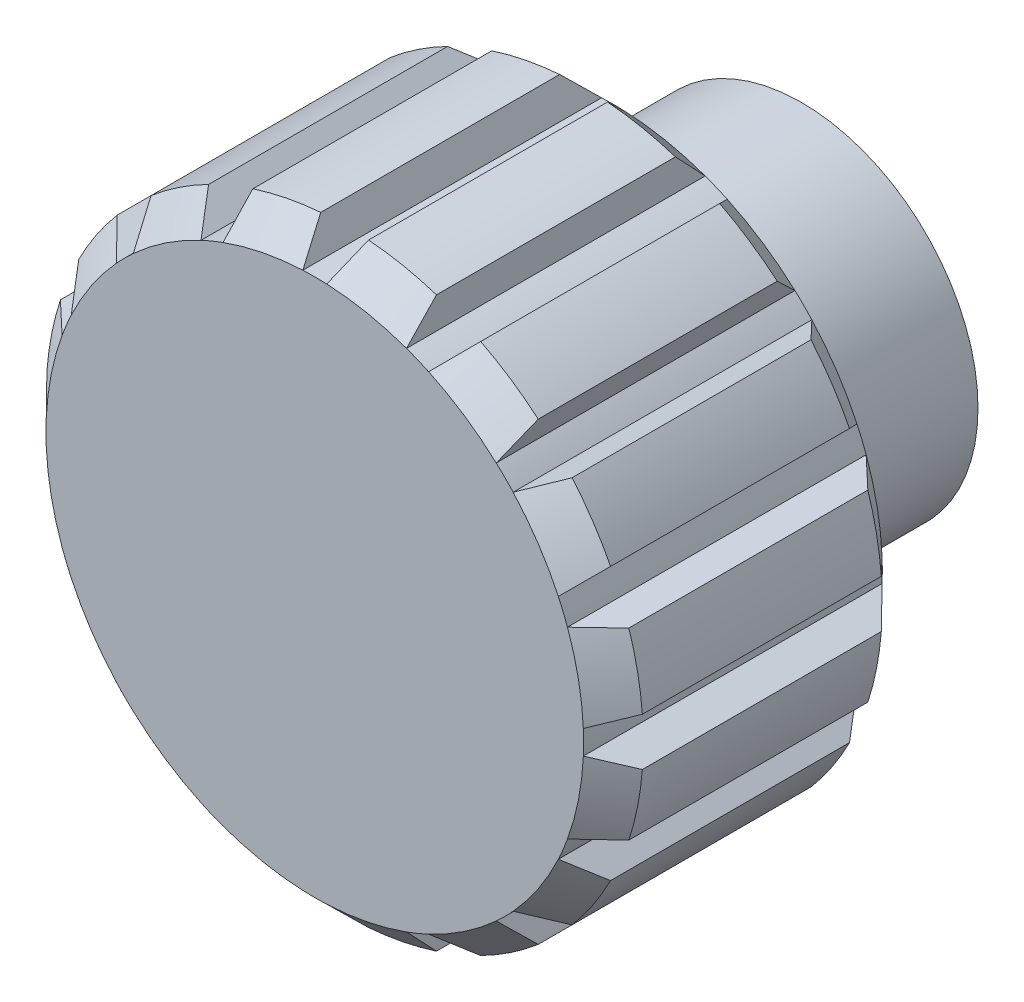
from build123d import *

# Parameters (mm, degrees)
SKETCH1_R           = 7.5
SKETCH1_R_2         = 3.5
BOSS_EXTRUDE1_DEPTH = 8
SKETCH2_R           = 12.7
BOSS_EXTRUDE2_DEPTH = 12.7
CHAMFER1_SIZE       = 1.27
CUT_EXTRUDE2_DEPTH  = 12.7


with BuildPart() as part:
    # Sketch1 → Boss-Extrude1 (new body)
    with BuildSketch(Plane.XY):
        Circle(SKETCH1_R)
        Circle(SKETCH1_R_2, mode=Mode.SUBTRACT)
    extrude(amount=BOSS_EXTRUDE1_DEPTH)

    # Sketch2 → Boss-Extrude2 (add)
    with BuildSketch(Plane.XY.offset(8)):
        Circle(SKETCH2_R)
    extrude(amount=BOSS_EXTRUDE2_DEPTH)

    # Chamfer1
    chamfer1_edges = [part.edges().sort_by_distance(p)[0] for p in [
        (-12.7, 0, 20.7),
        (-12.7, 0, 8),
    ]]
    chamfer(chamfer1_edges, length=CHAMFER1_SIZE)

    # Sketch3 → Cut-Extrude2 (cut)
    with BuildSketch(Plane.XY.offset(20.7)):
        with BuildLine():
            Line((-1.494578623, 13.823081897), (-0.508, 11.418705531))
            ThreePointArc((-0.508, 11.418705531), (0, 11.43), (0.508, 11.418705531))
            Line((0.508, 11.418705531), (1.494578623, 13.823081897))
            Line((1.494578623, 13.823081897), (-1.494578623, 13.823081897))
        make_face()
        with BuildLine():
            Line((3.909053826, 13.342812918), (6.670675026, 12.198911963))
            Line((6.670675026, 12.198911963), (4.839080228, 10.355105144))
            ThreePointArc((4.839080228, 10.355105144), (4.374071632, 10.559943057), (3.900418623, 10.743911511))
            Line((3.900418623, 10.743911511), (3.909053826, 13.342812918))
        make_face()
        with BuildLine():
            Line((8.717568266, 10.831221626), (10.831221626, 8.717568266))
            Line((10.831221626, 8.717568266), (8.433454358, 7.715033868))
            ThreePointArc((8.433454358, 7.715033868), (8.082230509, 8.082230509), (7.715033868, 8.433454358))
            Line((7.715033868, 8.433454358), (8.717568266, 10.831221626))
        make_face()
        with BuildLine():
            Line((12.198911963, 6.670675026), (13.342812918, 3.909053826))
            Line((13.342812918, 3.909053826), (10.743911511, 3.900418623))
            ThreePointArc((10.743911511, 3.900418623), (10.559943057, 4.374071632), (10.355105144, 4.839080228))
            Line((10.355105144, 4.839080228), (12.198911963, 6.670675026))
        make_face()
        with BuildLine():
            Line((13.823081897, 1.494578623), (13.823081897, -1.494578623))
            Line((13.823081897, -1.494578623), (11.418705531, -0.508))
            ThreePointArc((11.418705531, -0.508), (11.43, 0), (11.418705531, 0.508))
            Line((11.418705531, 0.508), (13.823081897, 1.494578623))
        make_face()
        with BuildLine():
            Line((13.342812918, -3.909053826), (12.198911963, -6.670675026))
            Line((12.198911963, -6.670675026), (10.355105144, -4.839080228))
            ThreePointArc((10.355105144, -4.839080228), (10.559943057, -4.374071632), (10.743911511, -3.900418623))
            Line((10.743911511, -3.900418623), (13.342812918, -3.909053826))
        make_face()
        with BuildLine():
            Line((10.831221626, -8.717568266), (8.717568266, -10.831221626))
            Line((8.717568266, -10.831221626), (7.715033868, -8.433454358))
            ThreePointArc((7.715033868, -8.433454358), (8.082230509, -8.082230509), (8.433454358, -7.715033868))
            Line((8.433454358, -7.715033868), (10.831221626, -8.717568266))
        make_face()
        with BuildLine():
            Line((6.670675026, -12.198911963), (3.909053826, -13.342812918))
            Line((3.909053826, -13.342812918), (3.900418623, -10.743911511))
            ThreePointArc((3.900418623, -10.743911511), (4.374071632, -10.559943057), (4.839080228, -10.355105144))
            Line((4.839080228, -10.355105144), (6.670675026, -12.198911963))
        make_face()
        with BuildLine():
            Line((1.494578623, -13.823081897), (-1.494578623, -13.823081897))
            Line((-1.494578623, -13.823081897), (-0.508, -11.418705531))
            ThreePointArc((-0.508, -11.418705531), (0, -11.43), (0.508, -11.418705531))
            Line((0.508, -11.418705531), (1.494578623, -13.823081897))
        make_face()
        with BuildLine():
            Line((-3.909053826, -13.342812918), (-6.670675026, -12.198911963))
            Line((-6.670675026, -12.198911963), (-4.839080228, -10.355105144))
            ThreePointArc((-4.839080228, -10.355105144), (-4.374071632, -10.559943057), (-3.900418623, -10.743911511))
            Line((-3.900418623, -10.743911511), (-3.909053826, -13.342812918))
        make_face()
        with BuildLine():
            Line((-8.717568266, -10.831221626), (-10.831221626, -8.717568266))
            Line((-10.831221626, -8.717568266), (-8.433454358, -7.715033868))
            ThreePointArc((-8.433454358, -7.715033868), (-8.082230509, -8.082230509), (-7.715033868, -8.433454358))
            Line((-7.715033868, -8.433454358), (-8.717568266, -10.831221626))
        make_face()
        with BuildLine():
            Line((-12.198911963, -6.670675026), (-13.342812918, -3.909053826))
            Line((-13.342812918, -3.909053826), (-10.743911511, -3.900418623))
            ThreePointArc((-10.743911511, -3.900418623), (-10.559943057, -4.374071632), (-10.355105144, -4.839080228))
            Line((-10.355105144, -4.839080228), (-12.198911963, -6.670675026))
        make_face()
        with BuildLine():
            Line((-13.823081897, -1.494578623), (-13.823081897, 1.494578623))
            Line((-13.823081897, 1.494578623), (-11.418705531, 0.508))
            ThreePointArc((-11.418705531, 0.508), (-11.43, 0), (-11.418705531, -0.508))
            Line((-11.418705531, -0.508), (-13.823081897, -1.494578623))
        make_face()
        with BuildLine():
            Line((-13.342812918, 3.909053826), (-12.198911963, 6.670675026))
            Line((-12.198911963, 6.670675026), (-10.355105144, 4.839080228))
            ThreePointArc((-10.355105144, 4.839080228), (-10.559943057, 4.374071632), (-10.743911511, 3.900418623))
            Line((-10.743911511, 3.900418623), (-13.342812918, 3.909053826))
        make_face()
        with BuildLine():
            Line((-10.831221626, 8.717568266), (-8.717568266, 10.831221626))
            Line((-8.717568266, 10.831221626), (-7.715033868, 8.433454358))
            ThreePointArc((-7.715033868, 8.433454358), (-8.082230509, 8.082230509), (-8.433454358, 7.715033868))
            Line((-8.433454358, 7.715033868), (-10.831221626, 8.717568266))
        make_face()
        with BuildLine():
            Line((-6.670675026, 12.198911963), (-3.909053826, 13.342812918))
            Line((-3.909053826, 13.342812918), (-3.900418623, 10.743911511))
            ThreePointArc((-3.900418623, 10.743911511), (-4.374071632, 10.559943057), (-4.839080228, 10.355105144))
            Line((-4.839080228, 10.355105144), (-6.670675026, 12.198911963))
        make_face()
    extrude(amount=-CUT_EXTRUDE2_DEPTH, mode=Mode.SUBTRACT)


solid = part.part
